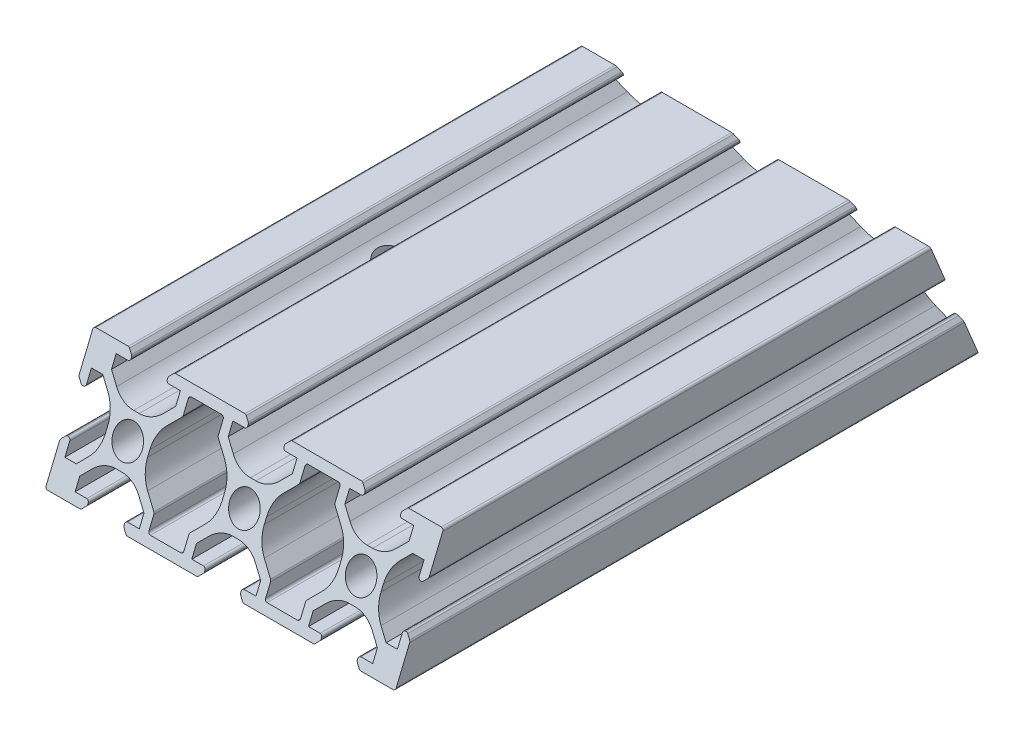
from build123d import *

# Parameters (mm, degrees)
RESSALTO_EXTRUS_O1_DEPTH    = 100
PADR_OCIRCULAR1_COUNT       = 4
PADR_O_LINEAR1_COUNT        = 3
PADR_O_LINEAR1_PITCH        = 20
PADR_O_LINEAR1_COPY_1_DEPTH = 100
PADR_O_LINEAR1_COPY_2_DEPTH = 100
PADR_O_LINEAR1_COPY_3_DEPTH = 100
PADR_O_LINEAR1_COPY_4_DEPTH = 100
PADR_O_LINEAR1_COPY_5_DEPTH = 100
PADR_O_LINEAR1_COPY_6_DEPTH = 100
CORTE_EXTRUS_O1_DEPTH       = 113.249721603
PADR_O_LINEAR2_COUNT        = 2
PADR_O_LINEAR2_PITCH        = 20
FILETE1_R                   = 0.4
FILETE2_R                   = 0.4
CUT_EXTRUDE1_DEPTH          = 118.046999107
CUT_EXTRUDE2_DEPTH          = 113.627527719
CUT_EXTRUDE2_DEPTH_BACK     = 113.627527719
SKETCH3_R                   = 3


with BuildPart() as part:
    # Esboço1 → Ressalto-extrusão1 (new body)
    with BuildSketch(Plane.XY):
        with BuildLine():
            ThreePointArc((-9.317157288, 3.217157288), (-9.187387948, 3.130448187), (-9.034314575, 3.1))
            Line((-9.034314575, 3.1), (-8.9, 3.1))
            ThreePointArc((-8.9, 3.1), (-8.617157288, 3.217157288), (-8.5, 3.5))
            Line((-8.5, 3.5), (-8.5, 5.5))
            Line((-8.5, 5.5), (-6.560660172, 5.5))
            Line((-6.560660172, 5.5), (-5.064466094, 4.003805922))
            ThreePointArc((-5.064466094, 4.003805922), (-3.980602337, 2.381689178), (-3.6, 0.468272016))
            Line((-3.6, 0.468272016), (-3.6, 0))
            Line((-3.6, 0), (-2.5, 0))
            ThreePointArc((-2.5, 0), (-1.767766953, 1.767766953), (0, 2.5))
            Line((0, 2.5), (0, 3.6))
            Line((0, 3.6), (-0.468272016, 3.6))
            ThreePointArc((-0.468272016, 3.6), (-2.381689178, 3.980602337), (-4.003805922, 5.064466094))
            Line((-4.003805922, 5.064466094), (-5.5, 6.560660172))
            Line((-5.5, 6.560660172), (-5.5, 8.5))
            Line((-5.5, 8.5), (-3.5, 8.5))
            ThreePointArc((-3.5, 8.5), (-3.217157288, 8.617157288), (-3.1, 8.9))
            Line((-3.1, 8.9), (-3.1, 9.034314575))
            ThreePointArc((-3.1, 9.034314575), (-3.130448187, 9.187387948), (-3.217157288, 9.317157288))
            Line((-3.217157288, 9.317157288), (-3.782842712, 9.882842712))
            ThreePointArc((-3.782842712, 9.882842712), (-3.912612052, 9.969551813), (-4.065685425, 10))
            Line((-4.065685425, 10), (-10, 10))
            Line((-10, 10), (-10, 4.065685425))
            ThreePointArc((-10, 4.065685425), (-9.969551813, 3.912612052), (-9.882842712, 3.782842712))
            Line((-9.882842712, 3.782842712), (-9.317157288, 3.217157288))
        make_face()
    ressalto_extrus_o1 = extrude(amount=RESSALTO_EXTRUS_O1_DEPTH)

    # PadrãoCircular1: Ressalto-extrusão1 ×4 about axis
    padr_ocircular1_axis = Axis((0, 0, 0), (0, 0, 1))
    for i in range(1, PADR_OCIRCULAR1_COUNT):
        add(ressalto_extrus_o1.rotate(padr_ocircular1_axis, i * 360 / PADR_OCIRCULAR1_COUNT))

    # Padrão linear1: Ressalto-extrusão1 ×3
    with Locations(*[(i * PADR_O_LINEAR1_PITCH, 0, 0) for i in range(1, PADR_O_LINEAR1_COUNT)]):
        add(ressalto_extrus_o1)

    # Padrão linear1 copy 1 sketch → Padrão linear1 copy 1 (add)
    with BuildSketch(Plane(origin=(20, 0, 0), x_dir=(0, 1, 0), z_dir=(0, 0, 1))):
        with BuildLine():
            ThreePointArc((-9.317157288, 3.217157288), (-9.187387948, 3.130448187), (-9.034314575, 3.1))
            Line((-9.034314575, 3.1), (-8.9, 3.1))
            ThreePointArc((-8.9, 3.1), (-8.617157288, 3.217157288), (-8.5, 3.5))
            Line((-8.5, 3.5), (-8.5, 5.5))
            Line((-8.5, 5.5), (-6.560660172, 5.5))
            Line((-6.560660172, 5.5), (-5.064466094, 4.003805922))
            ThreePointArc((-5.064466094, 4.003805922), (-3.980602337, 2.381689178), (-3.6, 0.468272016))
            Line((-3.6, 0.468272016), (-3.6, 0))
            Line((-3.6, 0), (-2.5, 0))
            ThreePointArc((-2.5, 0), (-1.767766953, 1.767766953), (0, 2.5))
            Line((0, 2.5), (0, 3.6))
            Line((0, 3.6), (-0.468272016, 3.6))
            ThreePointArc((-0.468272016, 3.6), (-2.381689178, 3.980602337), (-4.003805922, 5.064466094))
            Line((-4.003805922, 5.064466094), (-5.5, 6.560660172))
            Line((-5.5, 6.560660172), (-5.5, 8.5))
            Line((-5.5, 8.5), (-3.5, 8.5))
            ThreePointArc((-3.5, 8.5), (-3.217157288, 8.617157288), (-3.1, 8.9))
            Line((-3.1, 8.9), (-3.1, 9.034314575))
            ThreePointArc((-3.1, 9.034314575), (-3.130448187, 9.187387948), (-3.217157288, 9.317157288))
            Line((-3.217157288, 9.317157288), (-3.782842712, 9.882842712))
            ThreePointArc((-3.782842712, 9.882842712), (-3.912612052, 9.969551813), (-4.065685425, 10))
            Line((-4.065685425, 10), (-10, 10))
            Line((-10, 10), (-10, 4.065685425))
            ThreePointArc((-10, 4.065685425), (-9.969551813, 3.912612052), (-9.882842712, 3.782842712))
            Line((-9.882842712, 3.782842712), (-9.317157288, 3.217157288))
        make_face()
    extrude(amount=PADR_O_LINEAR1_COPY_1_DEPTH)

    # Padrão linear1 copy 2 sketch → Padrão linear1 copy 2 (add)
    with BuildSketch(Plane(origin=(40, 0, 0), x_dir=(0, 1, 0), z_dir=(0, 0, 1))):
        with BuildLine():
            ThreePointArc((-9.317157288, 3.217157288), (-9.187387948, 3.130448187), (-9.034314575, 3.1))
            Line((-9.034314575, 3.1), (-8.9, 3.1))
            ThreePointArc((-8.9, 3.1), (-8.617157288, 3.217157288), (-8.5, 3.5))
            Line((-8.5, 3.5), (-8.5, 5.5))
            Line((-8.5, 5.5), (-6.560660172, 5.5))
            Line((-6.560660172, 5.5), (-5.064466094, 4.003805922))
            ThreePointArc((-5.064466094, 4.003805922), (-3.980602337, 2.381689178), (-3.6, 0.468272016))
            Line((-3.6, 0.468272016), (-3.6, 0))
            Line((-3.6, 0), (-2.5, 0))
            ThreePointArc((-2.5, 0), (-1.767766953, 1.767766953), (0, 2.5))
            Line((0, 2.5), (0, 3.6))
            Line((0, 3.6), (-0.468272016, 3.6))
            ThreePointArc((-0.468272016, 3.6), (-2.381689178, 3.980602337), (-4.003805922, 5.064466094))
            Line((-4.003805922, 5.064466094), (-5.5, 6.560660172))
            Line((-5.5, 6.560660172), (-5.5, 8.5))
            Line((-5.5, 8.5), (-3.5, 8.5))
            ThreePointArc((-3.5, 8.5), (-3.217157288, 8.617157288), (-3.1, 8.9))
            Line((-3.1, 8.9), (-3.1, 9.034314575))
            ThreePointArc((-3.1, 9.034314575), (-3.130448187, 9.187387948), (-3.217157288, 9.317157288))
            Line((-3.217157288, 9.317157288), (-3.782842712, 9.882842712))
            ThreePointArc((-3.782842712, 9.882842712), (-3.912612052, 9.969551813), (-4.065685425, 10))
            Line((-4.065685425, 10), (-10, 10))
            Line((-10, 10), (-10, 4.065685425))
            ThreePointArc((-10, 4.065685425), (-9.969551813, 3.912612052), (-9.882842712, 3.782842712))
            Line((-9.882842712, 3.782842712), (-9.317157288, 3.217157288))
        make_face()
    extrude(amount=PADR_O_LINEAR1_COPY_2_DEPTH)

    # Padrão linear1 copy 3 sketch → Padrão linear1 copy 3 (add)
    with BuildSketch(Plane(origin=(20, 0, 0), x_dir=(-1, 0, 0), z_dir=(0, 0, 1))):
        with BuildLine():
            ThreePointArc((-9.317157288, 3.217157288), (-9.187387948, 3.130448187), (-9.034314575, 3.1))
            Line((-9.034314575, 3.1), (-8.9, 3.1))
            ThreePointArc((-8.9, 3.1), (-8.617157288, 3.217157288), (-8.5, 3.5))
            Line((-8.5, 3.5), (-8.5, 5.5))
            Line((-8.5, 5.5), (-6.560660172, 5.5))
            Line((-6.560660172, 5.5), (-5.064466094, 4.003805922))
            ThreePointArc((-5.064466094, 4.003805922), (-3.980602337, 2.381689178), (-3.6, 0.468272016))
            Line((-3.6, 0.468272016), (-3.6, 0))
            Line((-3.6, 0), (-2.5, 0))
            ThreePointArc((-2.5, 0), (-1.767766953, 1.767766953), (0, 2.5))
            Line((0, 2.5), (0, 3.6))
            Line((0, 3.6), (-0.468272016, 3.6))
            ThreePointArc((-0.468272016, 3.6), (-2.381689178, 3.980602337), (-4.003805922, 5.064466094))
            Line((-4.003805922, 5.064466094), (-5.5, 6.560660172))
            Line((-5.5, 6.560660172), (-5.5, 8.5))
            Line((-5.5, 8.5), (-3.5, 8.5))
            ThreePointArc((-3.5, 8.5), (-3.217157288, 8.617157288), (-3.1, 8.9))
            Line((-3.1, 8.9), (-3.1, 9.034314575))
            ThreePointArc((-3.1, 9.034314575), (-3.130448187, 9.187387948), (-3.217157288, 9.317157288))
            Line((-3.217157288, 9.317157288), (-3.782842712, 9.882842712))
            ThreePointArc((-3.782842712, 9.882842712), (-3.912612052, 9.969551813), (-4.065685425, 10))
            Line((-4.065685425, 10), (-10, 10))
            Line((-10, 10), (-10, 4.065685425))
            ThreePointArc((-10, 4.065685425), (-9.969551813, 3.912612052), (-9.882842712, 3.782842712))
            Line((-9.882842712, 3.782842712), (-9.317157288, 3.217157288))
        make_face()
    extrude(amount=PADR_O_LINEAR1_COPY_3_DEPTH)

    # Padrão linear1 copy 4 sketch → Padrão linear1 copy 4 (add)
    with BuildSketch(Plane(origin=(40, 0, 0), x_dir=(-1, 0, 0), z_dir=(0, 0, 1))):
        with BuildLine():
            ThreePointArc((-9.317157288, 3.217157288), (-9.187387948, 3.130448187), (-9.034314575, 3.1))
            Line((-9.034314575, 3.1), (-8.9, 3.1))
            ThreePointArc((-8.9, 3.1), (-8.617157288, 3.217157288), (-8.5, 3.5))
            Line((-8.5, 3.5), (-8.5, 5.5))
            Line((-8.5, 5.5), (-6.560660172, 5.5))
            Line((-6.560660172, 5.5), (-5.064466094, 4.003805922))
            ThreePointArc((-5.064466094, 4.003805922), (-3.980602337, 2.381689178), (-3.6, 0.468272016))
            Line((-3.6, 0.468272016), (-3.6, 0))
            Line((-3.6, 0), (-2.5, 0))
            ThreePointArc((-2.5, 0), (-1.767766953, 1.767766953), (0, 2.5))
            Line((0, 2.5), (0, 3.6))
            Line((0, 3.6), (-0.468272016, 3.6))
            ThreePointArc((-0.468272016, 3.6), (-2.381689178, 3.980602337), (-4.003805922, 5.064466094))
            Line((-4.003805922, 5.064466094), (-5.5, 6.560660172))
            Line((-5.5, 6.560660172), (-5.5, 8.5))
            Line((-5.5, 8.5), (-3.5, 8.5))
            ThreePointArc((-3.5, 8.5), (-3.217157288, 8.617157288), (-3.1, 8.9))
            Line((-3.1, 8.9), (-3.1, 9.034314575))
            ThreePointArc((-3.1, 9.034314575), (-3.130448187, 9.187387948), (-3.217157288, 9.317157288))
            Line((-3.217157288, 9.317157288), (-3.782842712, 9.882842712))
            ThreePointArc((-3.782842712, 9.882842712), (-3.912612052, 9.969551813), (-4.065685425, 10))
            Line((-4.065685425, 10), (-10, 10))
            Line((-10, 10), (-10, 4.065685425))
            ThreePointArc((-10, 4.065685425), (-9.969551813, 3.912612052), (-9.882842712, 3.782842712))
            Line((-9.882842712, 3.782842712), (-9.317157288, 3.217157288))
        make_face()
    extrude(amount=PADR_O_LINEAR1_COPY_4_DEPTH)

    # Padrão linear1 copy 5 sketch → Padrão linear1 copy 5 (add)
    with BuildSketch(Plane(origin=(20, 0, 0), x_dir=(0, -1, 0), z_dir=(0, 0, 1))):
        with BuildLine():
            ThreePointArc((-9.317157288, 3.217157288), (-9.187387948, 3.130448187), (-9.034314575, 3.1))
            Line((-9.034314575, 3.1), (-8.9, 3.1))
            ThreePointArc((-8.9, 3.1), (-8.617157288, 3.217157288), (-8.5, 3.5))
            Line((-8.5, 3.5), (-8.5, 5.5))
            Line((-8.5, 5.5), (-6.560660172, 5.5))
            Line((-6.560660172, 5.5), (-5.064466094, 4.003805922))
            ThreePointArc((-5.064466094, 4.003805922), (-3.980602337, 2.381689178), (-3.6, 0.468272016))
            Line((-3.6, 0.468272016), (-3.6, 0))
            Line((-3.6, 0), (-2.5, 0))
            ThreePointArc((-2.5, 0), (-1.767766953, 1.767766953), (0, 2.5))
            Line((0, 2.5), (0, 3.6))
            Line((0, 3.6), (-0.468272016, 3.6))
            ThreePointArc((-0.468272016, 3.6), (-2.381689178, 3.980602337), (-4.003805922, 5.064466094))
            Line((-4.003805922, 5.064466094), (-5.5, 6.560660172))
            Line((-5.5, 6.560660172), (-5.5, 8.5))
            Line((-5.5, 8.5), (-3.5, 8.5))
            ThreePointArc((-3.5, 8.5), (-3.217157288, 8.617157288), (-3.1, 8.9))
            Line((-3.1, 8.9), (-3.1, 9.034314575))
            ThreePointArc((-3.1, 9.034314575), (-3.130448187, 9.187387948), (-3.217157288, 9.317157288))
            Line((-3.217157288, 9.317157288), (-3.782842712, 9.882842712))
            ThreePointArc((-3.782842712, 9.882842712), (-3.912612052, 9.969551813), (-4.065685425, 10))
            Line((-4.065685425, 10), (-10, 10))
            Line((-10, 10), (-10, 4.065685425))
            ThreePointArc((-10, 4.065685425), (-9.969551813, 3.912612052), (-9.882842712, 3.782842712))
            Line((-9.882842712, 3.782842712), (-9.317157288, 3.217157288))
        make_face()
    extrude(amount=PADR_O_LINEAR1_COPY_5_DEPTH)

    # Padrão linear1 copy 6 sketch → Padrão linear1 copy 6 (add)
    with BuildSketch(Plane(origin=(40, 0, 0), x_dir=(0, -1, 0), z_dir=(0, 0, 1))):
        with BuildLine():
            ThreePointArc((-9.317157288, 3.217157288), (-9.187387948, 3.130448187), (-9.034314575, 3.1))
            Line((-9.034314575, 3.1), (-8.9, 3.1))
            ThreePointArc((-8.9, 3.1), (-8.617157288, 3.217157288), (-8.5, 3.5))
            Line((-8.5, 3.5), (-8.5, 5.5))
            Line((-8.5, 5.5), (-6.560660172, 5.5))
            Line((-6.560660172, 5.5), (-5.064466094, 4.003805922))
            ThreePointArc((-5.064466094, 4.003805922), (-3.980602337, 2.381689178), (-3.6, 0.468272016))
            Line((-3.6, 0.468272016), (-3.6, 0))
            Line((-3.6, 0), (-2.5, 0))
            ThreePointArc((-2.5, 0), (-1.767766953, 1.767766953), (0, 2.5))
            Line((0, 2.5), (0, 3.6))
            Line((0, 3.6), (-0.468272016, 3.6))
            ThreePointArc((-0.468272016, 3.6), (-2.381689178, 3.980602337), (-4.003805922, 5.064466094))
            Line((-4.003805922, 5.064466094), (-5.5, 6.560660172))
            Line((-5.5, 6.560660172), (-5.5, 8.5))
            Line((-5.5, 8.5), (-3.5, 8.5))
            ThreePointArc((-3.5, 8.5), (-3.217157288, 8.617157288), (-3.1, 8.9))
            Line((-3.1, 8.9), (-3.1, 9.034314575))
            ThreePointArc((-3.1, 9.034314575), (-3.130448187, 9.187387948), (-3.217157288, 9.317157288))
            Line((-3.217157288, 9.317157288), (-3.782842712, 9.882842712))
            ThreePointArc((-3.782842712, 9.882842712), (-3.912612052, 9.969551813), (-4.065685425, 10))
            Line((-4.065685425, 10), (-10, 10))
            Line((-10, 10), (-10, 4.065685425))
            ThreePointArc((-10, 4.065685425), (-9.969551813, 3.912612052), (-9.882842712, 3.782842712))
            Line((-9.882842712, 3.782842712), (-9.317157288, 3.217157288))
        make_face()
    extrude(amount=PADR_O_LINEAR1_COPY_6_DEPTH)

    # Esboço4 → Corte-extrusão1 (cut, through all)
    with BuildSketch(Plane(origin=(0, 0, 0), x_dir=(-1, 0, 0), z_dir=(0, 0, -1))):
        Polygon((-13.439339828, 5.5), (-13, 5.939339828), (-13, 8.5), (-7, 8.5), (-7, 5.939339828), (-6.560660172, 5.5), (-6.560660172, -5.5), (-7, -5.939339828), (-7, -8.5), (-13, -8.5), (-13, -5.939339828), (-13.439339828, -5.5), align=None)
    corte_extrus_o1 = extrude(amount=-CORTE_EXTRUS_O1_DEPTH, mode=Mode.SUBTRACT)

    # Padrão linear2: Corte-extrusão1 ×2
    with Locations(*[(i * PADR_O_LINEAR2_PITCH, 0, 0) for i in range(1, PADR_O_LINEAR2_COUNT)]):
        add(corte_extrus_o1, mode=Mode.SUBTRACT)

    # Filete1
    filete1_edges = [part.edges().sort_by_distance(p)[0] for p in [
        (13, 5.939339828, 50),
        (13, 8.5, 50),
        (7, 8.5, 50),
        (7, 5.939339828, 50),
        (7, -5.939339828, 50),
        (7, -8.5, 50),
        (13, -8.5, 50),
        (13, -5.939339828, 50),
        (33, 5.939339828, 50),
        (33, 8.5, 50),
        (27, 8.5, 50),
        (27, 5.939339828, 50),
        (27, -5.939339828, 50),
        (27, -8.5, 50),
        (33, -8.5, 50),
        (33, -5.939339828, 50),
    ]]
    fillet(filete1_edges, radius=FILETE1_R)

    # Filete2
    filete2_edges = [part.edges().sort_by_distance(p)[0] for p in [
        (-10, 10, 50),
        (50, -10, 50),
        (50, 10, 50),
        (-10, -10, 50),
    ]]
    fillet(filete2_edges, radius=FILETE2_R)

    # Sketch1 → Cut-Extrude1 (cut, through all)
    with BuildSketch(Plane.ZY.offset(10)):
        Polygon((0, 0), (0, -10), (12.426406871, 20), (0, 20), align=None)
        Polygon((87.573593129, 20), (100, 20), (100, 0), (100, -10), align=None)
    extrude(amount=-CUT_EXTRUDE1_DEPTH, mode=Mode.SUBTRACT)

    # Sketch3 → Cut-Extrude2 (cut, two sides: drawn at the far end of the back side and taken through both)
    with BuildSketch(Plane(origin=(0, 3.6, 0), x_dir=(1, 0, 0), z_dir=(0, 1, 0)).offset(-CUT_EXTRUDE2_DEPTH_BACK)):
        with Locations(Location((0, -50, 0), (0, 0, 261.019942871))):
            Circle(SKETCH3_R)
    extrude(amount=CUT_EXTRUDE2_DEPTH + CUT_EXTRUDE2_DEPTH_BACK, mode=Mode.SUBTRACT)


solid = part.part
